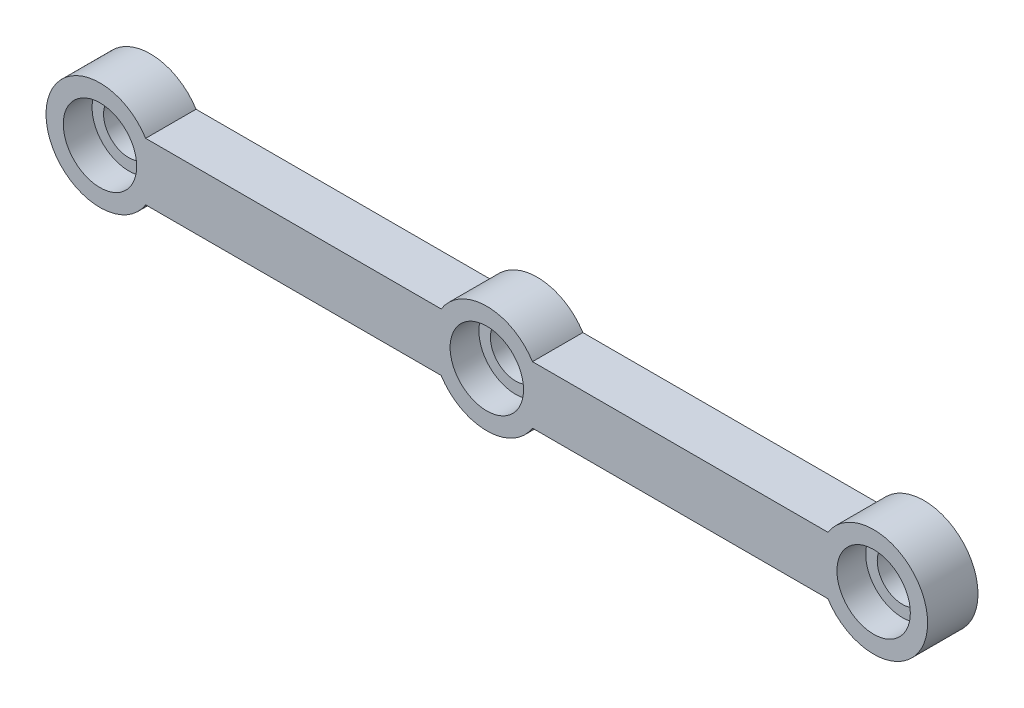
from build123d import *

# Parameters (mm, degrees)
SKETCH1_W           = 120
SKETCH1_H           = 8
SKETCH1_R           = 1.5
BOSS_EXTRUDE1_DEPTH = 3
FILLET2_R           = 4
FILLET3_R           = 4
FILLET4_R           = 4
SKETCH2_R           = 1.5
CUT_EXTRUDE1_DEPTH  = 3
CUT_EXTRUDE2_DEPTH  = 3
SKETCH4_R           = 1.5
BOSS_EXTRUDE2_DEPTH = 4
SKETCH5_R           = 7.5
SKETCH5_R_2         = 1.5
BOSS_EXTRUDE3_DEPTH = 7
SKETCH6_R           = 5
CUT_EXTRUDE3_DEPTH  = 4
SKETCH7_R           = 3.5
CUT_EXTRUDE4_DEPTH  = 4
SKETCH8_R           = 5.1
SKETCH8_R_2         = 5
CUT_EXTRUDE5_DEPTH  = 4


with BuildPart() as part:
    # Sketch1 → Boss-Extrude1 (new body)
    with BuildSketch(Plane.XY):
        Rectangle(SKETCH1_W, SKETCH1_H)
        Circle(SKETCH1_R, mode=Mode.SUBTRACT)
    extrude(amount=BOSS_EXTRUDE1_DEPTH)

    # Fillet2
    fillet2_edges = [part.edges().sort_by_distance(p)[0] for p in [
        (-60, 4, 1.5),
    ]]
    fillet(fillet2_edges, radius=FILLET2_R)

    # Fillet3
    fillet3_edges = [part.edges().sort_by_distance(p)[0] for p in [
        (-60, -4, 1.5),
    ]]
    fillet(fillet3_edges, radius=FILLET3_R - 0.0001)  # a hair under: the kernel refuses the full size

    # Fillet4
    fillet4_edges = [part.edges().sort_by_distance(p)[0] for p in [
        (60, -4, 1.5),
        (60, 4, 1.5),
    ]]
    fillet(fillet4_edges, radius=FILLET4_R - 0.0001)  # a hair under: the kernel refuses the full size

    # Sketch2 → Cut-Extrude1 (cut)
    with BuildSketch(Plane.XY.offset(3)):
        with Locations((-53.738621028, 0)):
            Circle(SKETCH2_R)
        with Locations((53.738621028, 0)):
            Circle(SKETCH2_R)
    extrude(amount=-CUT_EXTRUDE1_DEPTH, mode=Mode.SUBTRACT)

    # Sketch3 → Cut-Extrude2 (cut)
    with BuildSketch(Plane.XY.offset(3)):
        with BuildLine():
            ThreePointArc((-53.738621028, -4), (-57.738621028, 0), (-53.738621028, 4))
            Line((-53.738621028, 4), (-56, 4))
            ThreePointArc((-56, 4), (-58.828427125, 2.828427125), (-60, 0))
            ThreePointArc((-60, 0), (-58.828427125, -2.828427125), (-56, -4))
            Line((-56, -4), (-53.738621028, -4))
        make_face()
        with BuildLine():
            ThreePointArc((60, 0), (58.828427125, 2.828427125), (56, 4))
            Line((56, 4), (53.738621028, 4))
            ThreePointArc((53.738621028, 4), (57.738621028, 0), (53.738621028, -4))
            Line((53.738621028, -4), (56, -4))
            ThreePointArc((56, -4), (58.828427125, -2.828427125), (60, 0))
        make_face()
    extrude(amount=-CUT_EXTRUDE2_DEPTH, mode=Mode.SUBTRACT)


with BuildPart() as cut_extrude2_kept_piece:
    # of the separate pieces the step leaves, the one the design keeps (cut_extrude2_pieces_kept)
    add(part.part.solids().sort_by_distance((-53.738621028, -4, 0))[0])

    # Sketch4 → Boss-Extrude2 (add)
    with BuildSketch(Plane(origin=(0, 0, 0), x_dir=(-1, 0, 0), z_dir=(0, 0, -1))):
        with BuildLine():
            Line((53.738621028, 4), (-53.738621028, 4))
            ThreePointArc((-53.738621028, 4), (-57.738621028, 0), (-53.738621028, -4))
            Line((-53.738621028, -4), (53.738621028, -4))
            ThreePointArc((53.738621028, -4), (57.738621028, 0), (53.738621028, 4))
        make_face()
        with Locations(Location((-53.738621028, 0, 0), (0, 0, 180))):
            Circle(SKETCH4_R, mode=Mode.SUBTRACT)
        Circle(SKETCH4_R, mode=Mode.SUBTRACT)
        with Locations(Location((53.738621028, 0, 0), (0, 0, 180))):
            Circle(SKETCH4_R, mode=Mode.SUBTRACT)
    extrude(amount=BOSS_EXTRUDE2_DEPTH)

    # Sketch5 → Boss-Extrude3 (add, through all)
    # profile 1 of 3: a face of its own
    with BuildSketch(Plane.XY.offset(3)):
        with Locations((-53.738621028, 0)):
            Circle(SKETCH5_R)
        with Locations((-53.738621028, 0)):
            Circle(SKETCH5_R_2, mode=Mode.SUBTRACT)
    # profile 2 of 3: a face of its own
    with BuildSketch(Plane.XY.offset(3)):
        Circle(SKETCH5_R)
        with Locations(Location((0, 0, 0), (0, 0, 180))):
            Circle(SKETCH5_R_2, mode=Mode.SUBTRACT)
    # profile 3 of 3: a face of its own
    with BuildSketch(Plane.XY.offset(3)):
        with Locations((53.738621028, 0)):
            Circle(SKETCH5_R)
        with Locations((53.738621028, 0)):
            Circle(SKETCH5_R_2, mode=Mode.SUBTRACT)
    extrude(amount=-BOSS_EXTRUDE3_DEPTH)

    # Sketch6 → Cut-Extrude3 (cut)
    with BuildSketch(Plane.XY.offset(3)):
        with Locations((-53.738621028, 0)):
            Circle(SKETCH6_R)
        Circle(SKETCH6_R)
        with Locations((53.738621028, 0)):
            Circle(SKETCH6_R)
    extrude(amount=-CUT_EXTRUDE3_DEPTH, mode=Mode.SUBTRACT)

    # Sketch7 → Cut-Extrude4 (cut)
    with BuildSketch(Plane(origin=(0, 0, -4), x_dir=(-1, 0, 0), z_dir=(0, 0, -1))):
        with Locations((-53.738621028, 0)):
            Circle(SKETCH7_R)
        Circle(SKETCH7_R)
        with Locations((53.738621028, 0)):
            Circle(SKETCH7_R)
    extrude(amount=-CUT_EXTRUDE4_DEPTH, mode=Mode.SUBTRACT)

    # Sketch8 → Cut-Extrude5 (cut)
    # profile 1 of 3: a face of its own
    with BuildSketch(Plane.XY.offset(3)):
        with Locations((-53.738621028, 0)):
            Circle(SKETCH8_R)
        with Locations((-53.738621028, 0)):
            Circle(SKETCH8_R_2, mode=Mode.SUBTRACT)
    # profile 2 of 3: a face of its own
    with BuildSketch(Plane.XY.offset(3)):
        Circle(SKETCH8_R)
        Circle(SKETCH8_R_2, mode=Mode.SUBTRACT)
    # profile 3 of 3: a face of its own
    with BuildSketch(Plane.XY.offset(3)):
        with Locations((53.738621028, 0)):
            Circle(SKETCH8_R)
        with Locations((53.738621028, 0)):
            Circle(SKETCH8_R_2, mode=Mode.SUBTRACT)
    extrude(amount=-CUT_EXTRUDE5_DEPTH, mode=Mode.SUBTRACT)


solid = cut_extrude2_kept_piece.part
